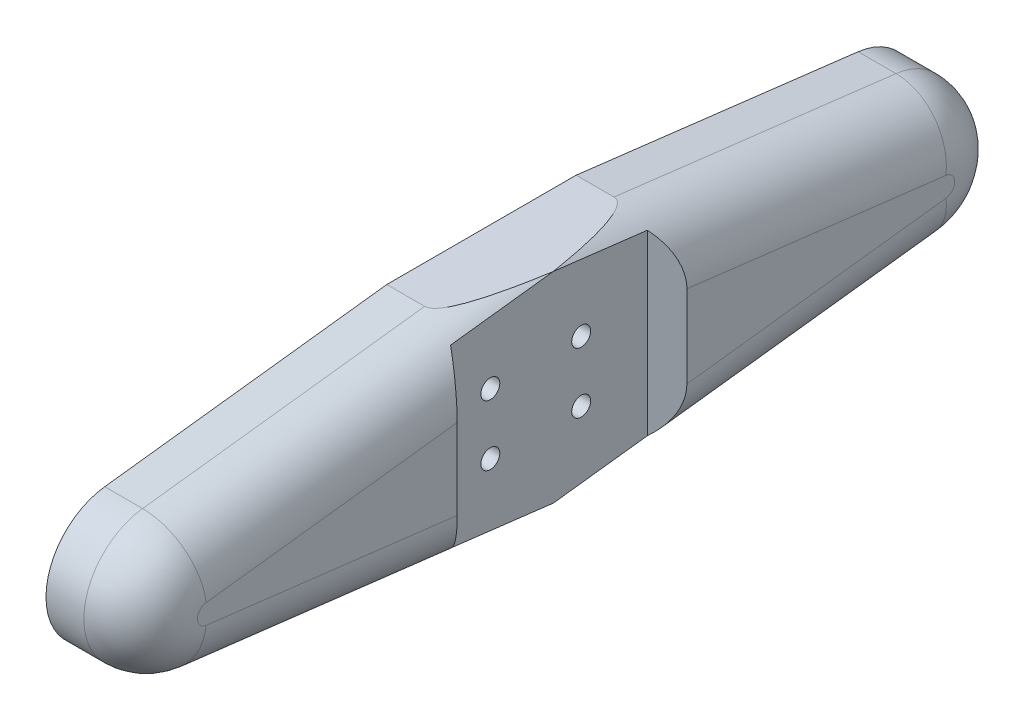
from build123d import *

# Parameters (mm, degrees)
EXTRUDE_1_DEPTH          = 25
FILLET_2_R               = 15
CUT_EXTRUDE_2_DEPTH      = 121.632707028
CUT_EXTRUDE_2_DEPTH_BACK = 121.632707028
SKETCH_9_R               = 2.5
CUT_EXTRUDE_3_DEPTH      = 120.533468117
PATTERN_LINEAR_1_COUNT   = 2
PATTERN_LINEAR_1_PITCH   = 24
CUT_EXTRUDE_4_DEPTH      = 14
SKETCH_11_R              = 7.5
SKETCH_11_R_2            = 3.25
EXTRUDE_3_DEPTH          = 14
PATTERN_LINEAR_2_COUNT   = 2
PATTERN_LINEAR_2_PITCH   = 195


with BuildPart() as part:
    # Эскиз4 → Бобышка-Вытянуть1 (new body)
    with BuildSketch(Plane(origin=(0, 0, 0), x_dir=(0, 0, -1), z_dir=(1, 0, 0))):
        with BuildLine():
            Line((-25, 26.5), (25, 26.5))
            Line((25, 26.5), (99.487179761, 17.5))
            ThreePointArc((99.487179761, 17.5), (115, 0), (99.487179761, -17.5))
            Line((99.487179761, -17.5), (25, -26.5))
            Line((25, -26.5), (-25, -26.5))
            Line((-25, -26.5), (-99.487179761, -17.5))
            ThreePointArc((-99.487179761, -17.5), (-115, 0), (-99.487179761, 17.5))
            Line((-99.487179761, 17.5), (-25, 26.5))
        make_face()
    extrude(amount=EXTRUDE_1_DEPTH)

    # Скругление2
    # the kernel refuses this fillet: 15 mm, written as the material it takes off along each edge
    with BuildSketch(Plane(origin=(25, 30.998265024, 12.229230609), x_dir=(-1, 0, 0), z_dir=(0, -0.11995373398361225, -0.9927794829182304)), Plane(origin=(25, 17.5, 99.487179761), x_dir=(-1, 0, 0), z_dir=(0, 0.11995373398361225, -0.9927794829182304)), Plane(origin=(25, -30.998265024, -12.229230609), x_dir=(-1, 0, 0), z_dir=(0, 0.11995373398361238, 0.9927794829182304)), Plane(origin=(25, -17.5, -99.487179761), x_dir=(-1, 0, 0), z_dir=(0, -0.1199537339836124, 0.9927794829182304))) as fillet_2_piece_1:
        with BuildLine():
            CenterArc((FILLET_2_R, -FILLET_2_R), FILLET_2_R, 90, 90)
            Line((0, -FILLET_2_R), (0, 0))
            Line((0, 0), (FILLET_2_R, 0))
        make_face()
    extrude(amount=112.528927413, mode=Mode.SUBTRACT)
    with BuildSketch(Plane(origin=(25, 0, -97.372721938), x_dir=(0, 0.9927794829182303, -0.11995373398361334), z_dir=(0, 0.11995373398361334, 0.9927794829182303))) as fillet_2_piece_2:
        with BuildLine():
            CenterArc((17.627278062 - FILLET_2_R, FILLET_2_R), FILLET_2_R, 270, 90)
            Line((17.627278062 - FILLET_2_R, 0), (17.627278062, 0))
            Line((17.627278062, 0), (17.627278062, FILLET_2_R))
        make_face()
    revolve(axis=Axis((25, 0, -97.372721938), (-1, 0, 0)), revolution_arc=166.221135111, mode=Mode.SUBTRACT)
    with BuildSketch(Plane(origin=(25, 0, 97.372721938), x_dir=(0, -0.9927794829182303, 0.11995373398361334), z_dir=(0, -0.11995373398361334, -0.9927794829182303))) as fillet_2_piece_3:
        with BuildLine():
            CenterArc((17.627278062 - FILLET_2_R, FILLET_2_R), FILLET_2_R, 270, 90)
            Line((17.627278062 - FILLET_2_R, 0), (17.627278062, 0))
            Line((17.627278062, 0), (17.627278062, FILLET_2_R))
        make_face()
    revolve(axis=Axis((25, 0, 97.372721938), (-1, 0, 0)), revolution_arc=166.221135111, mode=Mode.SUBTRACT)

    # Эскиз8 → Вырез-Вытянуть2 (cut, two sides: drawn at the far end of the back side and taken through both)
    with BuildSketch(Plane(origin=(0, 0, 0), x_dir=(1, 0, 0), z_dir=(0, 1, 0)).offset(-CUT_EXTRUDE_2_DEPTH_BACK)):
        Polygon((19, -27.152763866), (19, 24.847236134), (28, 31.474618083), (28, -33.525381917), align=None)
    extrude(amount=CUT_EXTRUDE_2_DEPTH + CUT_EXTRUDE_2_DEPTH_BACK, mode=Mode.SUBTRACT)

    # Эскиз9 → Вырез-Вытянуть3 (cut, through all)
    with BuildSketch(Plane(origin=(19, 0, 0), x_dir=(0, 0, -1), z_dir=(1, 0, 0))):
        with Locations((-16.652763866, 8)):
            Circle(SKETCH_9_R)
        with Locations((-16.652763866, -8)):
            Circle(SKETCH_9_R)
    cut_extrude_3 = extrude(amount=-CUT_EXTRUDE_3_DEPTH, mode=Mode.SUBTRACT)

    # Линейный массив1: Вырез-Вытянуть3 ×2
    with Locations(*[(0, 0, -i * PATTERN_LINEAR_1_PITCH) for i in range(1, PATTERN_LINEAR_1_COUNT)]):
        add(cut_extrude_3, mode=Mode.SUBTRACT)

    # Эскиз10 → Вырез-Вытянуть4 (cut)
    with BuildSketch(Plane.ZY):
        with BuildLine():
            Line((99.007364825, 13.528882068), (24.759223266, 22.5))
            Line((24.759223266, 22.5), (-24.759223266, 22.5))
            Line((-24.759223266, 22.5), (-99.007364825, 13.528882068))
            ThreePointArc((-99.007364825, 13.528882068), (-111, 0), (-99.007364825, -13.528882068))
            Line((-99.007364825, -13.528882068), (-24.759223266, -22.5))
            Line((-24.759223266, -22.5), (24.759223266, -22.5))
            Line((24.759223266, -22.5), (99.007364825, -13.528882068))
            ThreePointArc((99.007364825, -13.528882068), (111, 0), (99.007364825, 13.528882068))
        make_face()
    extrude(amount=-CUT_EXTRUDE_4_DEPTH, mode=Mode.SUBTRACT)

    # Эскиз11 → Бобышка-Вытянуть3 (add)
    with BuildSketch(Plane.ZY.offset(-14)):
        with Locations((97.552941864, 0)):
            Circle(SKETCH_11_R)
        with Locations((97.552941864, 0)):
            Circle(SKETCH_11_R_2, mode=Mode.SUBTRACT)
    extrude_3 = extrude(amount=EXTRUDE_3_DEPTH)

    # Линейный массив2: Бобышка-Вытянуть3 ×2
    with Locations(*[(0, 0, -i * PATTERN_LINEAR_2_PITCH) for i in range(1, PATTERN_LINEAR_2_COUNT)]):
        add(extrude_3)


solid = part.part
